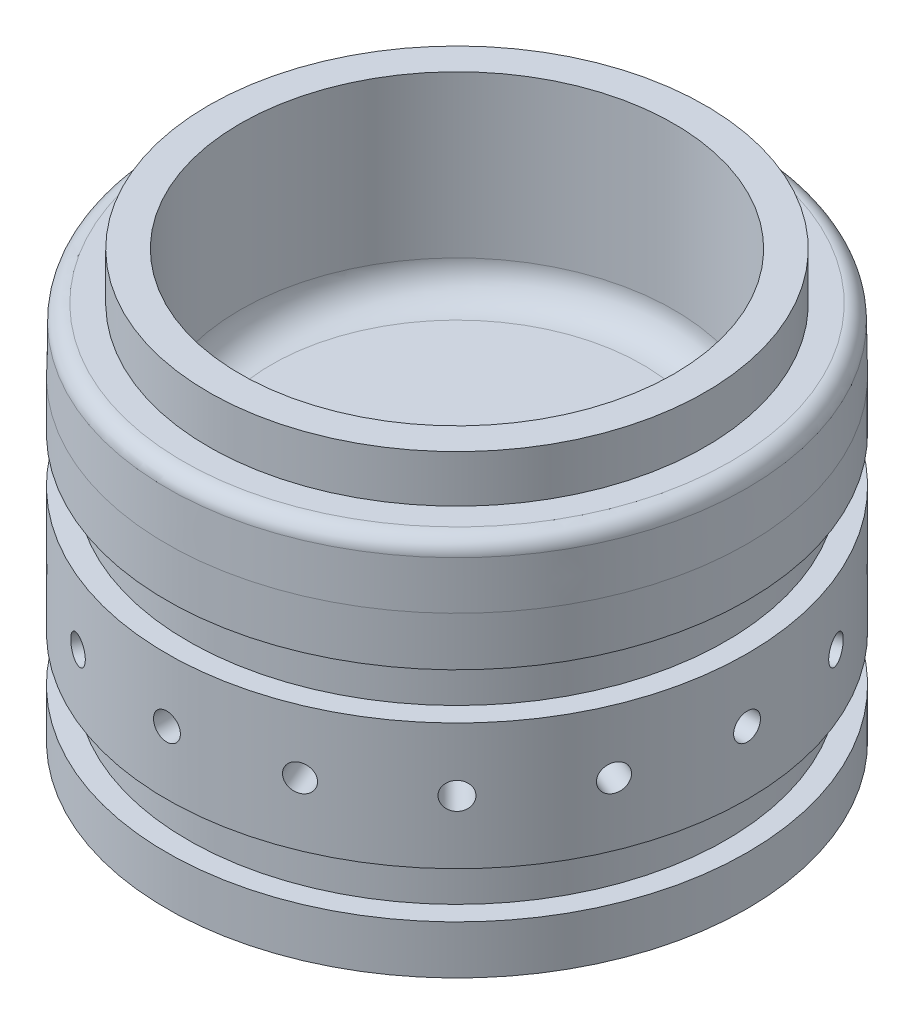
from build123d import *

# Parameters (mm, degrees)
TAPERFILLET_R     = 3.175
HOLEPATTERN_COUNT = 16
POCKETFILLETS_R   = 6.35


with BuildPart() as part:
    # Sketch1 → Revolve1 (revolve)
    with BuildSketch(Plane.XY):
        Polygon((0, -15.24), (0, 15.24), (-43.6499, 15.24), (-43.6499, 54.0385), (-49.9999, 54.0385), (-49.9999, 44.5262), (-58.236420675, 44.5262), (-58.4454, 31.8262), (-58.4454, 21.971), (-54.1274, 21.971), (-54.1274, 12.7), (-58.4454, 12.7), (-58.4454, -12.7), (-54.1274, -12.7), (-54.1274, -21.971), (-58.4454, -21.971), (-58.4454, -31.75), (-48.9331, -31.75), (-48.9331, -15.24), align=None)
    revolve(axis=Axis((0, 31.75, 0), (0, -1, 0)))

    # TaperFillet
    taperfillet_edges = [part.edges().sort_by_distance(p)[0] for p in [
        (58.236420675, 44.5262, 0),
    ]]
    fillet(taperfillet_edges, radius=TAPERFILLET_R)

    # Sketch4 → Tap Drill for 1/4-28 Tap1 (revolve, cut)
    with BuildSketch(Plane(origin=(0, 0, -58.4454), x_dir=(0, 1, 0), z_dir=(1, 0, 0))):
        Polygon((0, 0), (0, 20.675388061), (2.7051, 19.05), (2.7051, 0), align=None)
    tap_drill_for_1_4_28_tap1 = revolve(axis=Axis((0, 0, -64.7954), (0, 0, 1)), mode=Mode.SUBTRACT)

    # HolePattern: Tap Drill for 1/4-28 Tap1 ×16 about axis
    holepattern_axis = Axis((0, -12.7, 0), (0, 1, 0))
    for i in range(1, HOLEPATTERN_COUNT):
        add(tap_drill_for_1_4_28_tap1.rotate(holepattern_axis, i * 360 / HOLEPATTERN_COUNT), mode=Mode.SUBTRACT)

    # PocketFillets
    pocketfillets_edges = [part.edges().sort_by_distance(p)[0] for p in [
        (43.6499, 15.24, 0),
        (48.9331, -15.24, 0),
    ]]
    fillet(pocketfillets_edges, radius=POCKETFILLETS_R)


solid = part.part
